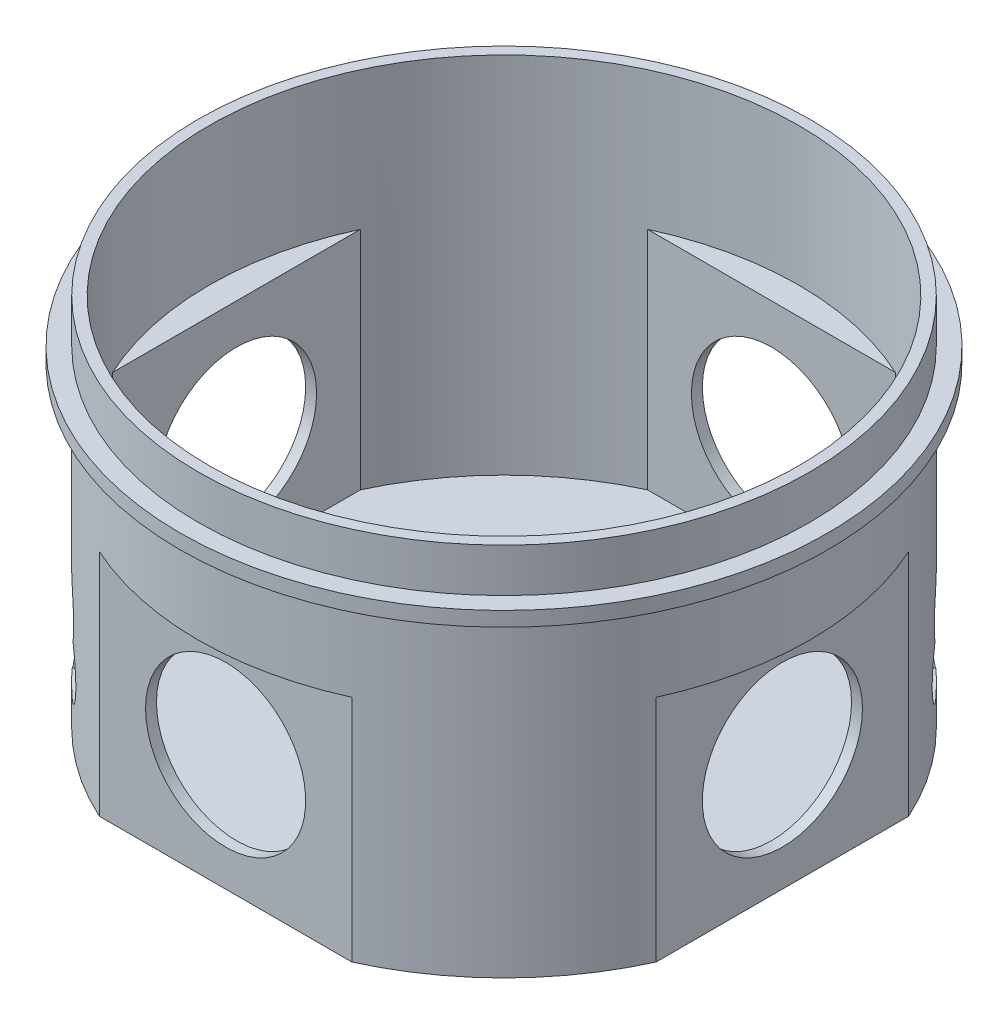
from build123d import *
from build123d.topology import SkipClean

# Parameters (mm, degrees)
EXTRUDE_1_DEPTH          = 1.5
EXTRUDE_2_DEPTH          = 30
SKETCH_3_R               = 42
EXTRUDE_3_DEPTH          = 1
SKETCH_4_R               = 42
SKETCH_4_R_2             = 40.5
EXTRUDE_4_DEPTH          = 11
SKETCH_5_R               = 44.50000000000001
SKETCH_5_R_2             = 40.5
EXTRUDE_5_DEPTH          = 2
SKETCH_6_R               = 42
SKETCH_6_R_2             = 40.5
EXTRUDE_6_DEPTH          = 6
SKETCH_7_R               = 11
CUT_EXTRUDE_1_DEPTH      = 108.14505354891564
PATTERN_CIRCULAR_1_COUNT = 2
PATTERN_CIRCULAR_1_ANGLE = 90.0000000000002
CUT_EXTRUDE_2_DEPTH      = 82.31881701057881
CUT_EXTRUDE_2_DEPTH_BACK = 82.31881701057881
SKETCH_8_R               = 4
SKETCH_8_R_2             = 4.000000000000001


with BuildPart() as part:
    # Эскиз1 → Бобышка-Вытянуть1 (new body)
    with BuildSketch(Plane(origin=(0, 0, 0), x_dir=(1, 0, 0), z_dir=(0, 1, 0))):
        with BuildLine():
            Line((17.347550259331598, 38.25), (-17.347550259330436, 38.25))
            ThreePointArc((-17.347550259330443, 38.25000000000006), (-29.698484809834387, 29.698484809835605), (-38.24999999999934, 17.34755025933202))
            Line((-38.25, 17.34755025933216), (-38.25, -17.34755025933218))
            ThreePointArc((-38.249999999999325, -17.347550259332046), (-29.698484809834383, -29.698484809835612), (-17.34755025933046, -38.25000000000004))
            Line((-17.347550259330426, -38.25), (17.34755025933157, -38.25))
            ThreePointArc((17.347550259331467, -38.249999999999595), (29.69848480983491, -29.698484809835083), (38.24999999999949, -17.347550259331687))
            Line((38.25, -17.34755025933179), (38.25, 17.347550259331754))
            ThreePointArc((38.2499999999995, 17.347550259331655), (29.69848480983494, 29.69848480983505), (17.347550259331513, 38.249999999999574))
        make_face()
    extrude(amount=EXTRUDE_1_DEPTH)

    # Эскиз2 → Бобышка-Вытянуть2 (add)
    with BuildSketch(Plane(origin=(0, 1.5, 0), x_dir=(1, 0, 0), z_dir=(0, 1, 0))):
        with BuildLine():
            Line((-17.34755025933057, -38.25), (17.34755025933057, -38.25))
            ThreePointArc((17.34755025933057, -38.25), (29.698484809834998, -29.698484809834994), (38.25, -17.347550259330568))
            Line((38.25, -17.347550259330568), (38.25, 17.34755025933057))
            ThreePointArc((38.25, 17.34755025933057), (29.698484809834998, 29.698484809834994), (17.347550259330568, 38.25))
            Line((17.347550259330568, 38.25), (-17.34755025933057, 38.25))
            ThreePointArc((-17.34755025933057, 38.25), (-29.698484809834994, 29.698484809834998), (-38.25, 17.347550259330582))
            Line((-38.25, 17.347550259330582), (-38.25, -17.34755025933057))
            ThreePointArc((-38.25, -17.34755025933057), (-29.698484809834994, -29.698484809834998), (-17.34755025933057, -38.25))
        make_face()
        with BuildLine():
            Line((-17.020208576865333, -36.75), (17.020208576865333, -36.75))
            ThreePointArc((17.020208576865333, -36.75), (28.637824638055175, -28.63782463805517), (36.75, -17.020208576865333))
            Line((36.75, -17.020208576865333), (36.75, 17.020208576865333))
            ThreePointArc((36.75, 17.020208576865333), (28.637824638055175, 28.63782463805517), (17.020208576865333, 36.75))
            Line((17.020208576865333, 36.75), (-17.020208576865333, 36.75))
            ThreePointArc((-17.020208576865333, 36.75), (-28.63782463805517, 28.637824638055175), (-36.75, 17.020208576865333))
            Line((-36.75, 17.020208576865333), (-36.75, -17.020208576865333))
            ThreePointArc((-36.75, -17.020208576865333), (-28.63782463805517, -28.637824638055175), (-17.020208576865333, -36.75))
        make_face(mode=Mode.SUBTRACT)
    extrude(amount=EXTRUDE_2_DEPTH)

    # Эскиз3 → Бобышка-Вытянуть3 (add)
    with BuildSketch(Plane(origin=(0, 31.5, 0), x_dir=(1, 0, 0), z_dir=(0, 1, 0))):
        Circle(SKETCH_3_R)
        with BuildLine():
            ThreePointArc((36.74999999999999, -17.020208576865343), (28.637824638055168, -28.637824638055182), (17.02020857686533, -36.75))
            Line((17.020208576865333, -36.75), (-17.020208576865333, -36.75))
            ThreePointArc((-17.020208576865343, -36.74999999999999), (-28.637824638055182, -28.63782463805517), (-36.75, -17.02020857686533))
            Line((-36.75, -17.020208576865333), (-36.75, 17.02020857686534))
            ThreePointArc((-36.74999999999999, 17.02020857686534), (-28.63782463805517, 28.637824638055175), (-17.020208576865333, 36.75))
            Line((-17.020208576865333, 36.75), (17.020208576865326, 36.75000000000001))
            ThreePointArc((17.02020857686533, 36.75), (28.637824638055175, 28.63782463805517), (36.75, 17.020208576865333))
            Line((36.75, 17.020208576865333), (36.75, -17.020208576865333))
        make_face(mode=Mode.SUBTRACT)
    extrude(amount=EXTRUDE_3_DEPTH)

    # Эскиз4 → Бобышка-Вытянуть4 (add)
    with SkipClean():  # the faces are left unmerged after this step: merging them gives an invalid solid
        with BuildSketch(Plane(origin=(0, 32.5, 0), x_dir=(1, 0, 0), z_dir=(0, 1, 0))):
            Circle(SKETCH_4_R)
            Circle(SKETCH_4_R_2, mode=Mode.SUBTRACT)
        extrude(amount=EXTRUDE_4_DEPTH)

    # Эскиз5 → Бобышка-Вытянуть5 (add)
    with BuildSketch(Plane(origin=(0, 43.5, 0), x_dir=(1, 0, 0), z_dir=(0, 1, 0))):
        Circle(SKETCH_5_R)
        Circle(SKETCH_5_R_2, mode=Mode.SUBTRACT)
    extrude(amount=EXTRUDE_5_DEPTH)

    # Эскиз6 → Бобышка-Вытянуть6 (add)
    with BuildSketch(Plane(origin=(0, 45.5, 0), x_dir=(1, 0, 0), z_dir=(0, 1, 0))):
        Circle(SKETCH_6_R)
        Circle(SKETCH_6_R_2, mode=Mode.SUBTRACT)
    extrude(amount=EXTRUDE_6_DEPTH)

    # Эскиз7 → Вырез-Вытянуть1 (cut, through all)
    with BuildSketch(Plane(origin=(38.25, 0, 0), x_dir=(0, 0, -1), z_dir=(1, 0, 0))):
        with Locations((0, 16)):
            Circle(SKETCH_7_R)
    cut_extrude_1 = extrude(amount=-CUT_EXTRUDE_1_DEPTH, mode=Mode.SUBTRACT)

    # Круговой массив1: Вырез-Вытянуть1 ×2 about axis
    pattern_circular_1_axis = Axis((0, 51.5, 0), (0, 1, 0))
    for i in range(1, PATTERN_CIRCULAR_1_COUNT):
        add(cut_extrude_1.rotate(pattern_circular_1_axis, i * PATTERN_CIRCULAR_1_ANGLE / (PATTERN_CIRCULAR_1_COUNT - 1)), mode=Mode.SUBTRACT)

    # Эскиз8 → Вырез-Вытянуть2 (cut, two sides: drawn at the far end of the back side and taken through both)
    with BuildSketch(Plane(origin=(0, 0, 0), x_dir=(0.7071067811865477, 0, 0.7071067811865475), z_dir=(-0.7071067811865475, 0, 0.7071067811865477)).offset(-CUT_EXTRUDE_2_DEPTH_BACK)):
        with Locations((-4.219736044961651, 9.000000000000002)):
            Circle(SKETCH_8_R)
        with Locations((0, 15)):
            Circle(SKETCH_8_R)
        with Locations((1.7802639550383494, 9.000000000000002)):
            Circle(SKETCH_8_R_2)
    extrude(amount=CUT_EXTRUDE_2_DEPTH + CUT_EXTRUDE_2_DEPTH_BACK, mode=Mode.SUBTRACT)


solid = part.part
